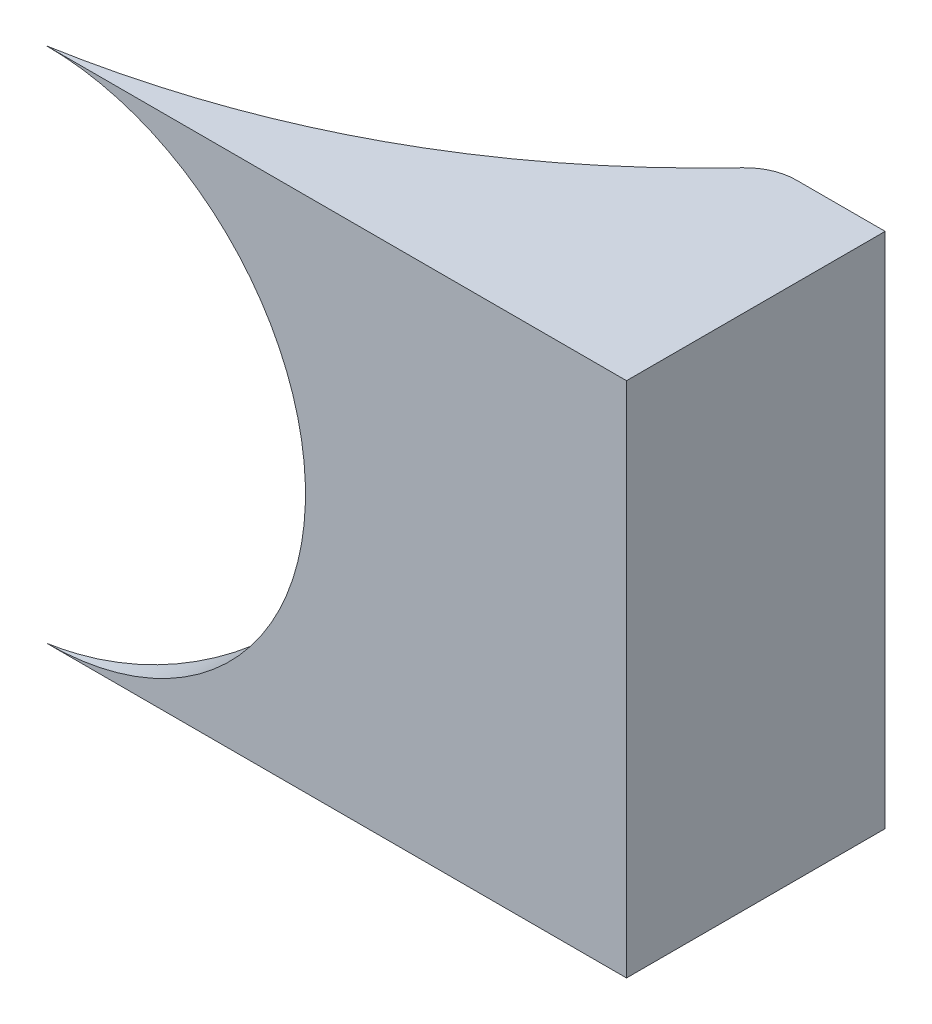
from build123d import *

# Parameters (mm, degrees)
BOSS_EXTRUDE1_DEPTH     = 50
CUT_EXTRUDE1_DEPTH      = 122
CUT_EXTRUDE1_DEPTH_BACK = 98
FILLET1_R               = 10


with BuildPart() as part:
    # Sketch1 → Boss-Extrude1 (new body)
    with BuildSketch(Plane.XY):
        with BuildLine():
            Line((112.060798049, 50), (0, 50))
            ThreePointArc((0, 50), (35.355339059, 35.355339059), (50, 0))
            ThreePointArc((50, 0), (35.355339059, -35.355339059), (0, -50))
            Line((0, -50), (112.060798049, -50))
            Line((112.060798049, -50), (112.060798049, 50))
        make_face()
    extrude(amount=BOSS_EXTRUDE1_DEPTH)

    # Sketch2 → Cut-Extrude1 (cut, two sides: drawn at the far end of the back side and taken through both)
    with BuildSketch(Plane(origin=(0, 0, 0), x_dir=(1, 0, 0), z_dir=(0, 1, 0)).offset(-CUT_EXTRUDE1_DEPTH_BACK)):
        with BuildLine():
            Line((90.490413338, 0), (0, 0))
            Line((0, 0), (0, -50))
            add(Edge.make_bspline(
                [(0, -50), (54.321214116, -40.505522655), (90.490413338, 0)],
                knots=[0, 0, 0, 1, 1, 1], degree=2))
        make_face()
    extrude(amount=CUT_EXTRUDE1_DEPTH + CUT_EXTRUDE1_DEPTH_BACK, mode=Mode.SUBTRACT)

    # Fillet1
    fillet1_edges = [part.edges().sort_by_distance(p)[0] for p in [
        (90.490413338, 25, 0),
    ]]
    fillet(fillet1_edges, radius=FILLET1_R)


solid = part.part
